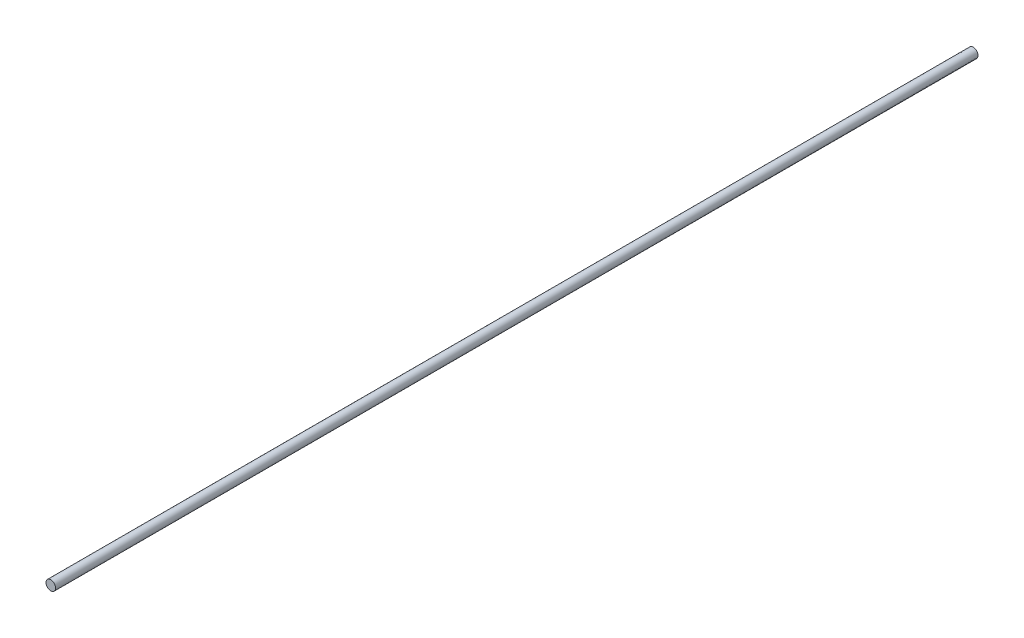
from build123d import *

# Parameters (mm, degrees)
SKETCH1_R           = 0.79375
BOSS_EXTRUDE1_DEPTH = 152.4


with BuildPart() as part:
    # Sketch1 → Boss-Extrude1 (new body)
    with BuildSketch(Plane.XY):
        Circle(SKETCH1_R)
    extrude(amount=BOSS_EXTRUDE1_DEPTH)


solid = part.part
